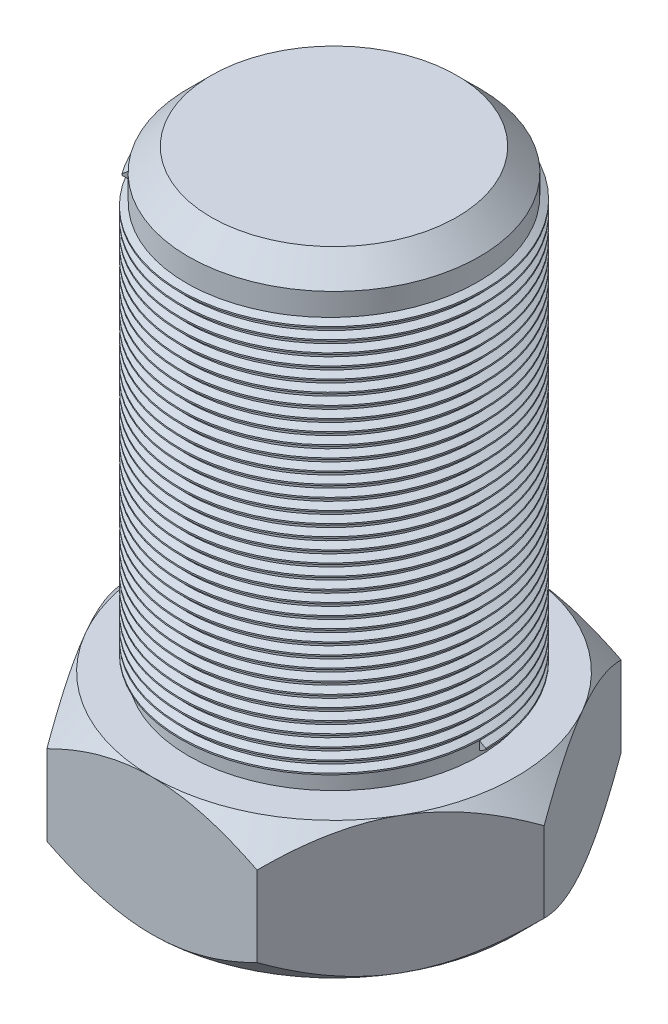
from build123d import *

# Parameters (mm, degrees)
BOSS_EXTRUDE1_DEPTH     = 1.5
SKETCH2_OUTSIDE_W       = 29.368
SKETCH2_OUTSIDE_H       = 28.13
SKETCH2_OUTSIDE_R       = 4
CUT_EXTRUDE1_DEPTH      = 7.806859286
CUT_EXTRUDE1_DRAFT      = -45
MIRROR2_COPY_1_SKETCH_W = 29.368
MIRROR2_COPY_1_SKETCH_H = 28.13
MIRROR2_COPY_1_SKETCH_R = 4
MIRROR2_COPY_1_DEPTH    = 7.806859286
MIRROR2_COPY_1_DRAFT    = -45
SKETCH3_R               = 3.2
BOSS_EXTRUDE2_DEPTH     = 10
CHAMFER1_SIZE           = 0.5
THREAD2_PITCH           = 0.25


with BuildPart() as part:
    # Sketch1 → Boss-Extrude1 (new, symmetric)
    with BuildSketch(Plane(origin=(0, 0, 0), x_dir=(1, 0, 0), z_dir=(0, 1, 0))):
        Polygon((4.618802154, 0), (2.309401077, 4), (-2.309401077, 4), (-4.618802154, 0), (-2.309401077, -4), (2.309401077, -4), align=None)
    extrude(amount=BOSS_EXTRUDE1_DEPTH, both=True)


with BuildPart() as cut_extrude1_tool:
    # Sketch2 outside → Cut-Extrude1 (with draft: the straight prism first)
    with BuildSketch(Plane(origin=(0, 1.5, 0), x_dir=(1, 0, 0), z_dir=(0, 1, 0))):
        Rectangle(SKETCH2_OUTSIDE_W, SKETCH2_OUTSIDE_H)
        Circle(SKETCH2_OUTSIDE_R, mode=Mode.SUBTRACT)
    extrude(amount=-CUT_EXTRUDE1_DEPTH)
    # Cut-Extrude1: the draft: its side faces are tilted about the plane it starts from
    cut_extrude1_sides = [cut_extrude1_tool.faces().sort_by_distance(p)[0] for p in [
        (0, -2.403429643, 14.065),
        (14.684, -2.403429643, 0),
        (0, -2.403429643, -14.065),
        (-14.684, -2.403429643, 0),
        (-4, -2.403429643, 0),
    ]]
    draft(cut_extrude1_sides, Plane(origin=(0, 1.5, 0), x_dir=(1, 0, 0), z_dir=(0, 1, 0)), CUT_EXTRUDE1_DRAFT)


with BuildPart() as part_1:
    add(part.part)

    # Cut-Extrude1: cut by cut_extrude1_tool
    add(cut_extrude1_tool.part, mode=Mode.SUBTRACT)


with BuildPart() as mirror2_copy_1_tool:
    # Mirror2 copy 1 sketch → Mirror2 copy 1 (with draft: the straight prism first)
    with BuildSketch(Plane.XZ.offset(1.5)):
        Rectangle(MIRROR2_COPY_1_SKETCH_W, MIRROR2_COPY_1_SKETCH_H)
        Circle(MIRROR2_COPY_1_SKETCH_R, mode=Mode.SUBTRACT)
    extrude(amount=-MIRROR2_COPY_1_DEPTH)
    # Mirror2 copy 1: the draft: its side faces are tilted about the plane it starts from
    mirror2_copy_1_sides = [mirror2_copy_1_tool.faces().sort_by_distance(p)[0] for p in [
        (0, 2.403429643, 14.065),
        (14.684, 2.403429643, 0),
        (0, 2.403429643, -14.065),
        (-14.684, 2.403429643, 0),
        (-4, 2.403429643, 0),
    ]]
    draft(mirror2_copy_1_sides, Plane.XZ.offset(1.5), MIRROR2_COPY_1_DRAFT)


with BuildPart() as part_2:
    add(part_1.part)

    # Mirror2 copy 1: cut by mirror2_copy_1_tool
    add(mirror2_copy_1_tool.part, mode=Mode.SUBTRACT)

    # Sketch3 → Boss-Extrude2 (add)
    with BuildSketch(Plane(origin=(0, 1.5, 0), x_dir=(1, 0, 0), z_dir=(0, 1, 0))):
        with Locations(Location((0, 0, 0), (0, 0, 270))):
            Circle(SKETCH3_R)
    extrude(amount=BOSS_EXTRUDE2_DEPTH)

    # Chamfer1
    chamfer1_edges = [part_2.edges().sort_by_distance(p)[0] for p in [
        (0, 11.5, -3.2),
    ]]
    chamfer(chamfer1_edges, length=CHAMFER1_SIZE)

    # Thread2: arcs per turn and ends read off the stored shape
    # Thread2: the profile of Thread Profile2 profile screwed along a right-hand helix through 35.6 turns, 6 arcs to a turn; built about Z, then put on its axis
    thread2_z = Axis((0, 0, 0), (0, 0, 1))
    thread2_corners = [(3.1997, 0, -0.000173205), (3.335316469, 0, 0.078125), (3.335316469, 0, 0.109375), (3.1997, 0, 0.187673204)]
    with BuildLine(mode=Mode.PRIVATE) as thread2_profile:
        Line(thread2_corners[0], thread2_corners[1])
        Line(thread2_corners[1], thread2_corners[2])
        Line(thread2_corners[2], thread2_corners[3])
        Line(thread2_corners[3], thread2_corners[0])
    thread2_cap = Face(thread2_profile.wire())
    thread2_turn_angles = [0, 30, 60, 90, 120, 150, 180, 210, 240, 270, 300, 330, 360]
    thread2_turn_weights = [1, 0.8660254037844387, 1, 0.8660254037844387, 1, 0.8660254037844387, 1, 0.8660254037844387, 1, 0.8660254037844387, 1, 0.8660254037844387, 1]
    thread2_turn_rails = [Edge.make_bspline([Vector(p[0], p[1], 0).rotate(thread2_z, thread2_turn_angles[k]) / thread2_turn_weights[k] + Vector(0, 0, p[2] + THREAD2_PITCH * thread2_turn_angles[k] / 360) for k in range(13)], [0, 0, 0, 1, 1, 2, 2, 3, 3, 4, 4, 5, 5, 6, 6, 6], 2, thread2_turn_weights) for p in thread2_corners]
    thread2_turn_sides = [Face.make_surface_from_curves(thread2_turn_rails[p[0]], thread2_turn_rails[p[1]]) for p in [(0, 1), (1, 2), (2, 3), (3, 0)]]
    thread2_last_angles = [12600, 12630, 12660, 12690, 12720, 12750, 12780, 12798, 12816]
    thread2_last_weights = [1, 0.8660254037844387, 1, 0.8660254037844387, 1, 0.8660254037844387, 1, 0.9510565162951535, 1]
    thread2_last_rails = [Edge.make_bspline([Vector(p[0], p[1], 0).rotate(thread2_z, thread2_last_angles[k]) / thread2_last_weights[k] + Vector(0, 0, p[2] + THREAD2_PITCH * thread2_last_angles[k] / 360) for k in range(9)], [0, 0, 0, 1, 1, 2, 2, 3, 3, 4, 4, 4], 2, thread2_last_weights) for p in thread2_corners]
    thread2_last_sides = [Face.make_surface_from_curves(thread2_last_rails[p[0]], thread2_last_rails[p[1]]) for p in [(0, 1), (1, 2), (2, 3), (3, 0)]]
    thread2 = Plane(origin=(0, 1.6, 0), x_dir=(1, 0, 0), z_dir=(0, 1, 0)) * Solid(Shell([*[p.moved(Location((0, 0, THREAD2_PITCH * i))) for i in range(35) for p in thread2_turn_sides], *thread2_last_sides, thread2_cap, thread2_cap.rotate(thread2_z, 12816).moved(Location((0, 0, THREAD2_PITCH * 12816 / 360)))]))
    add(thread2)


solid = part_2.part
